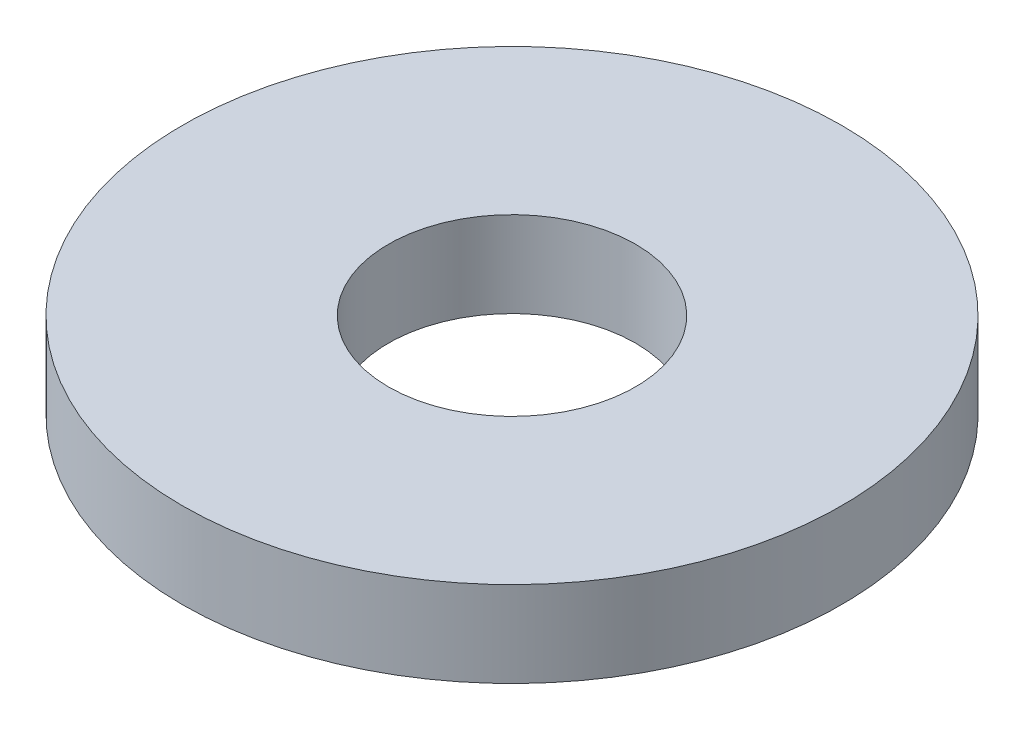
from build123d import *

# Parameters (mm, degrees)
SKETCH1_R           = 100
BOSS_EXTRUDE1_DEPTH = 26
SKETCH2_R           = 37.5
CUT_EXTRUDE1_DEPTH  = 144.791515744


with BuildPart() as part:
    # Sketch1 → Boss-Extrude1 (new body)
    with BuildSketch(Plane(origin=(0, 0, 0), x_dir=(1, 0, 0), z_dir=(0, 1, 0))):
        Circle(SKETCH1_R)
    extrude(amount=BOSS_EXTRUDE1_DEPTH)

    # Sketch2 → Cut-Extrude1 (cut, through all)
    with BuildSketch(Plane(origin=(0, 0, 0), x_dir=(1, 0, 0), z_dir=(0, 1, 0))):
        Circle(SKETCH2_R)
    extrude(amount=CUT_EXTRUDE1_DEPTH, mode=Mode.SUBTRACT)


solid = part.part
